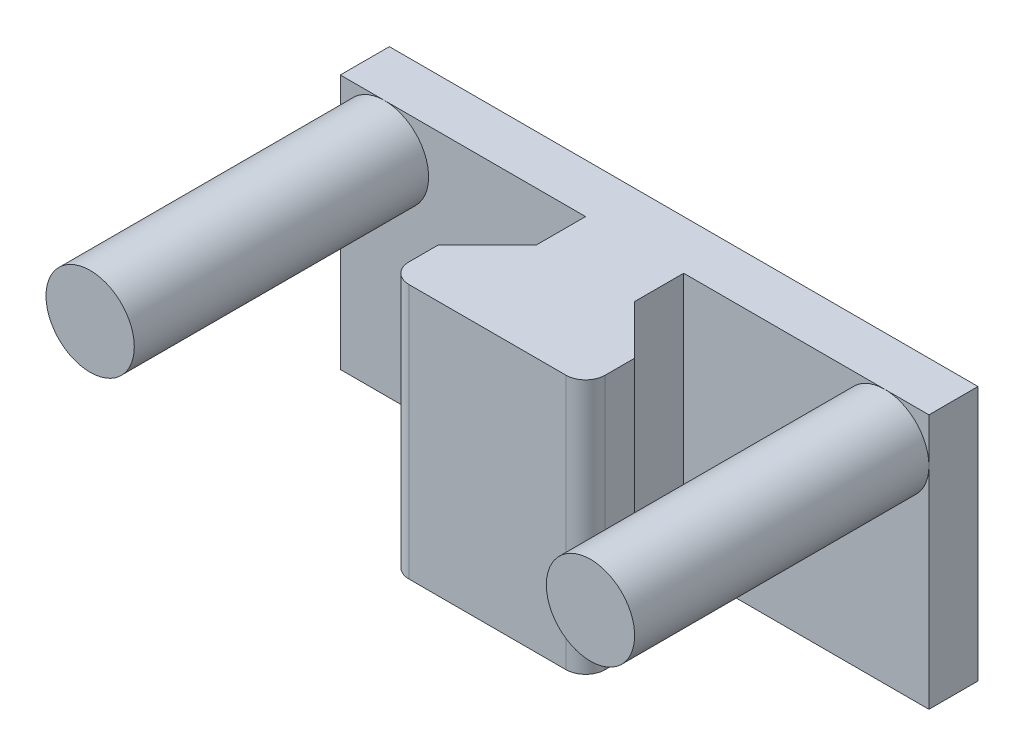
from build123d import *

# Parameters (mm, degrees)
BOSS_EXTRUDE1_DEPTH = 26
SKETCH2_R           = 4.5
BOSS_EXTRUDE2_DEPTH = 30
FILLET1_R           = 2
CHAMFER1_SIZE       = 5


with BuildPart() as part:
    # Sketch1 → Boss-Extrude1 (new body)
    with BuildSketch(Plane(origin=(0, 0, 0), x_dir=(1, 0, 0), z_dir=(0, 1, 0))):
        Polygon((-10, 0), (0, 0), (0, 20), (-30, 20), (-30, 15), (-5, 15), (-5, 5), (-10, 5), align=None)
        Polygon((0, 0), (10, 0), (10, 5), (5, 5), (5, 15), (30, 15), (30, 20), (0, 20), align=None)
    extrude(amount=BOSS_EXTRUDE1_DEPTH)

    # Sketch2 → Boss-Extrude2 (add)
    with BuildSketch(Plane.XY.offset(-15)):
        with Locations(Location((-25.5, 21.5, 0), (0, 0, 180))):
            Circle(SKETCH2_R)
    boss_extrude2 = extrude(amount=BOSS_EXTRUDE2_DEPTH)

    # Mirror1: Boss-Extrude2 across plane
    add(boss_extrude2.mirror(Plane(origin=(0, 0, 0), x_dir=(0, 0, 1), z_dir=(1, 0, 0))))

    # Fillet1
    fillet1_edges = [part.edges().sort_by_distance(p)[0] for p in [
        (-10, 13, 0),
        (10, 13, 0),
    ]]
    fillet(fillet1_edges, radius=FILLET1_R)

    # Chamfer1
    chamfer1_edges = [part.edges().sort_by_distance(p)[0] for p in [
        (5, 13, -5),
        (-5, 13, -5),
    ]]
    chamfer(chamfer1_edges, length=CHAMFER1_SIZE - 0.0001)  # a hair under: the kernel refuses the full size


solid = part.part
